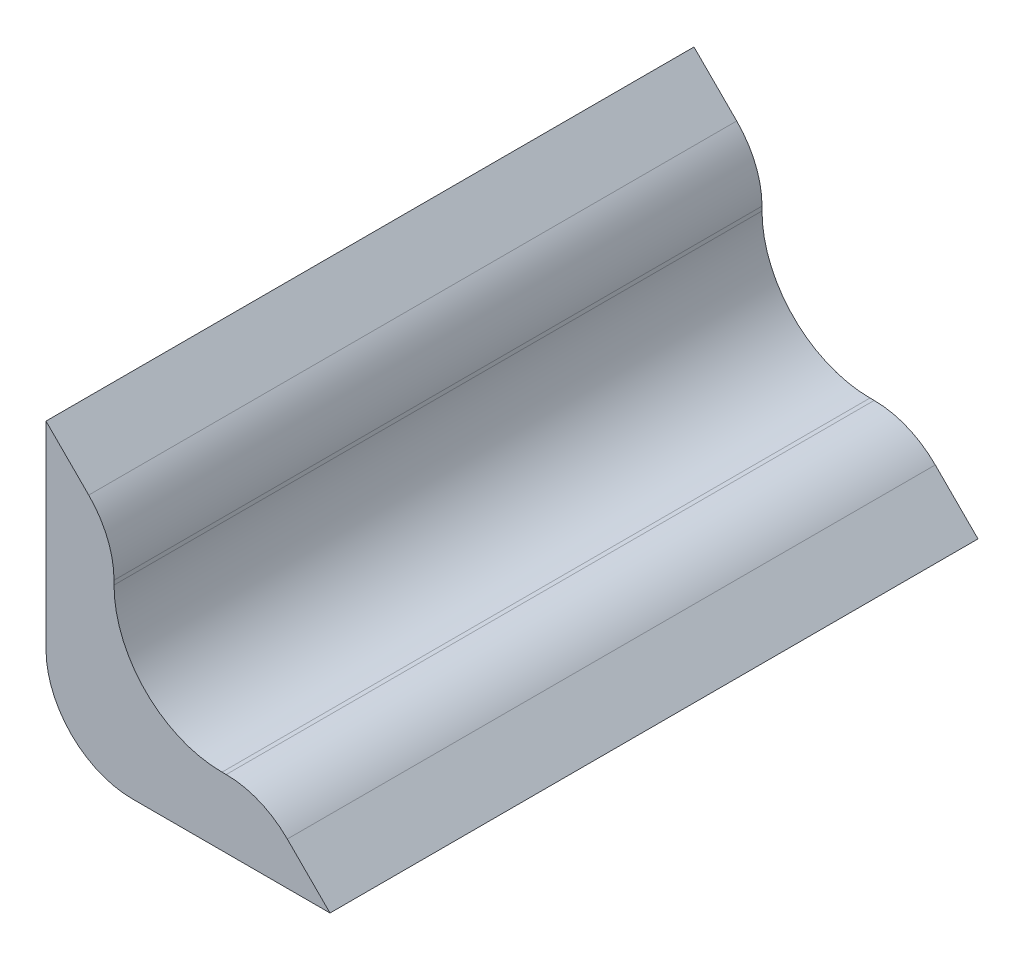
from build123d import *

# Parameters (mm, degrees)
BOSS_EXTRUDE1_DEPTH = 9.525
CHAMFER1_SIZE       = 2
FILLET1_R           = 2.54
FILLET2_R           = 2.54
FILLET3_R           = 3.175


with BuildPart() as part:
    # Sketch1 → Boss-Extrude1 (new, symmetric)
    with BuildSketch(Plane.XY):
        Polygon((0, 0), (8.35, 0), (8.35, 2), (2, 2), (2, 8.35), (0, 8.35), align=None)
    extrude(amount=BOSS_EXTRUDE1_DEPTH, both=True)

    # Chamfer1
    chamfer1_edges = [part.edges().sort_by_distance(p)[0] for p in [
        (8.35, 2, 0),
        (2, 8.35, 0),
    ]]
    chamfer(chamfer1_edges, length=CHAMFER1_SIZE - 0.0001)  # a hair under: the kernel refuses the full size

    # Fillet1
    fillet1_edges = [part.edges().sort_by_distance(p)[0] for p in [
        (6.3501, 2, 0),
        (2, 6.3501, 0),
    ]]
    fillet(fillet1_edges, radius=FILLET1_R)

    # Fillet2
    fillet2_edges = [part.edges().sort_by_distance(p)[0] for p in [
        (0, 0, 0),
    ]]
    fillet(fillet2_edges, radius=FILLET2_R)

    # Fillet3
    fillet3_edges = [part.edges().sort_by_distance(p)[0] for p in [
        (2, 2, 0),
    ]]
    fillet(fillet3_edges, radius=FILLET3_R)


solid = part.part
